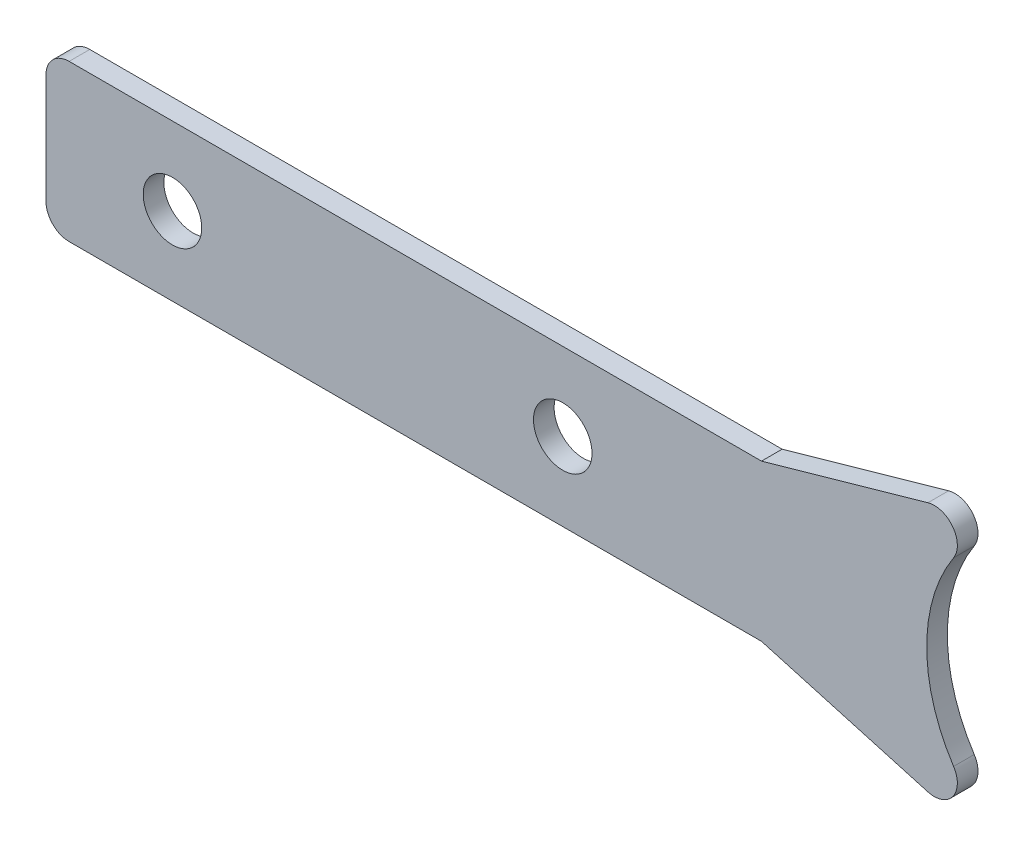
from build123d import *

# Parameters (mm, degrees)
BOSS_EXTRUDE1_DEPTH  = 1.5875
FILLET2_DEPTH        = 1.5875
M4_CLEARANCE_HOLE1_D = 4.5


with BuildPart() as part:
    # Sketch1 → Boss-Extrude1 (new body)
    with BuildSketch(Plane.XY):
        with BuildLine():
            Line((27.5, 6), (-27.5, 6))
            Line((-27.5, 6), (-27.5, -6))
            Line((-27.5, -6), (27.5, -6))
            Line((27.5, -6), (49.436268592, -12.218533657))
            ThreePointArc((49.436268592, -12.218533657), (40.2, -4.45e-07), (49.436267736, 12.218533415))
            Line((49.436267736, 12.218533415), (27.5, 6))
        make_face()
    extrude(amount=BOSS_EXTRUDE1_DEPTH)

    # Fillet2: read off the stored shape, not the designer's step
    # Fillet2 outline → Fillet2 (cut)
    with BuildSketch(Plane.XY):
        with BuildLine():
            ThreePointArc((-27.5, 4.222), (-26.979235857, 5.479235857), (-25.722, 6))
            Line((-25.722, 6), (-27.5, 6))
            Line((-27.5, 6), (-27.5, 4.222))
        make_face()
        with BuildLine():
            ThreePointArc((-25.722, -6), (-26.979235857, -5.479235857), (-27.5, -4.222))
            Line((-27.5, -4.222), (-27.5, -6))
            Line((-27.5, -6), (-25.722, -6))
        make_face()
        with BuildLine():
            Line((49.436267736, 12.218533415), (40.292754575, 9.626513532))
            ThreePointArc((40.292754575, 9.626513532), (42.209860363, 8.969548331), (42.266383414, 6.943788468))
            ThreePointArc((42.266383414, 6.943788468), (45.374075159, 10.229880512), (49.436267736, 12.218533415))
        make_face()
        with BuildLine():
            ThreePointArc((49.436267736, -12.218533415), (45.374075159, -10.229880512), (42.266383413, -6.943788468))
            ThreePointArc((42.266383413, -6.943788468), (42.209860363, -8.969548331), (40.292754575, -9.626513532))
            Line((40.292754575, -9.626513532), (49.436267736, -12.218533415))
        make_face()
    extrude(amount=FILLET2_DEPTH, mode=Mode.SUBTRACT)

    # M4 Clearance Hole1 (through all)
    with Locations(Plane.XY.offset(1.5875)):
        with Locations((-17.778, 0), (12.221650814, 0)):
            Hole(M4_CLEARANCE_HOLE1_D / 2)


solid = part.part
